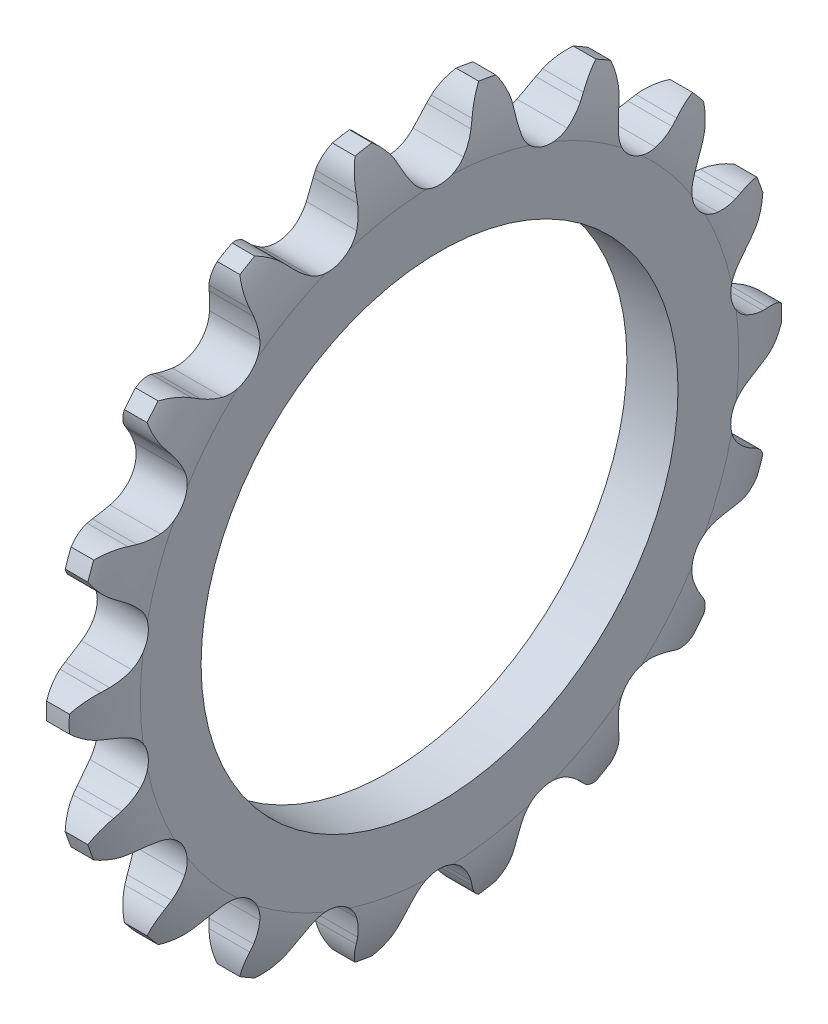
from build123d import *

# Parameters (mm, degrees)
TOOTHCUT_DEPTH  = 43.455441271
TEETHCUTS_COUNT = 18
BORSKE_R        = 20
BORE_DEPTH      = 50.8000508


with BuildPart() as part:
    # BasProSke → Base-Revolve (revolve)
    with BuildSketch(Plane(origin=(0, 0, 0), x_dir=(1, 0, 0), z_dir=(0, 1, 0))):
        with BuildLine():
            Line((0, 0), (0, 25.091779697))
            ThreePointArc((0, 25.091779697), (0.302973008, 27.552861445), (1.1938, 29.866979697))
            Line((1.1938, 29.866979697), (3.094736, 29.866979697))
            ThreePointArc((3.094736, 29.866979697), (3.985562992, 27.552861445), (4.288536, 25.091779697))
            Line((4.288536, 25.091779697), (4.288536, 0))
            Line((4.288536, 0), (0, 0))
        make_face()
    revolve(axis=Axis((-10, 0, 0), (1, 0, 0)))

    # TooCutSke → ToothCut (cut, through all)
    with BuildSketch(Plane(origin=(0, 0, 0), x_dir=(0, 0, -1), z_dir=(1, 0, 0))):
        with BuildLine():
            Line((2.91755625, 27.299104928), (3.159984547, 27.858133533))
            ThreePointArc((3.159984547, 27.858133533), (4.704984353, 29.693963379), (7.00395274, 30.38101504))
            ThreePointArc((7.00395274, 30.38101504), (0, 31.177899686), (-7.00395274, 30.38101504))
            ThreePointArc((-7.00395274, 30.38101504), (-4.704984353, 29.693963379), (-3.159984547, 27.858133533))
            Line((-3.159984547, 27.858133533), (-2.91755625, 27.299104928))
            ThreePointArc((-2.91755625, 27.299104928), (-2.523047708, 26.530374597), (-2.032264105, 25.819238346))
            ThreePointArc((-2.032264105, 25.819238346), (0, 24.835344457), (2.032264105, 25.819238346))
            ThreePointArc((2.032264105, 25.819238346), (2.523047708, 26.530374597), (2.91755625, 27.299104928))
        make_face()
    toothcut = extrude(amount=TOOTHCUT_DEPTH, mode=Mode.SUBTRACT)

    # TeethCuts: ToothCut ×18 about axis
    teethcuts_axis = Axis((-10, 0, 0), (1, 0, 0))
    for i in range(1, TEETHCUTS_COUNT):
        add(toothcut.rotate(teethcuts_axis, i * 360 / TEETHCUTS_COUNT), mode=Mode.SUBTRACT)

    # BorSke → Bore (cut, symmetric)
    with BuildSketch(Plane(origin=(0, 0, 0), x_dir=(0, 0, -1), z_dir=(1, 0, 0))):
        Circle(BORSKE_R)
    extrude(amount=BORE_DEPTH, both=True, mode=Mode.SUBTRACT)


solid = part.part
